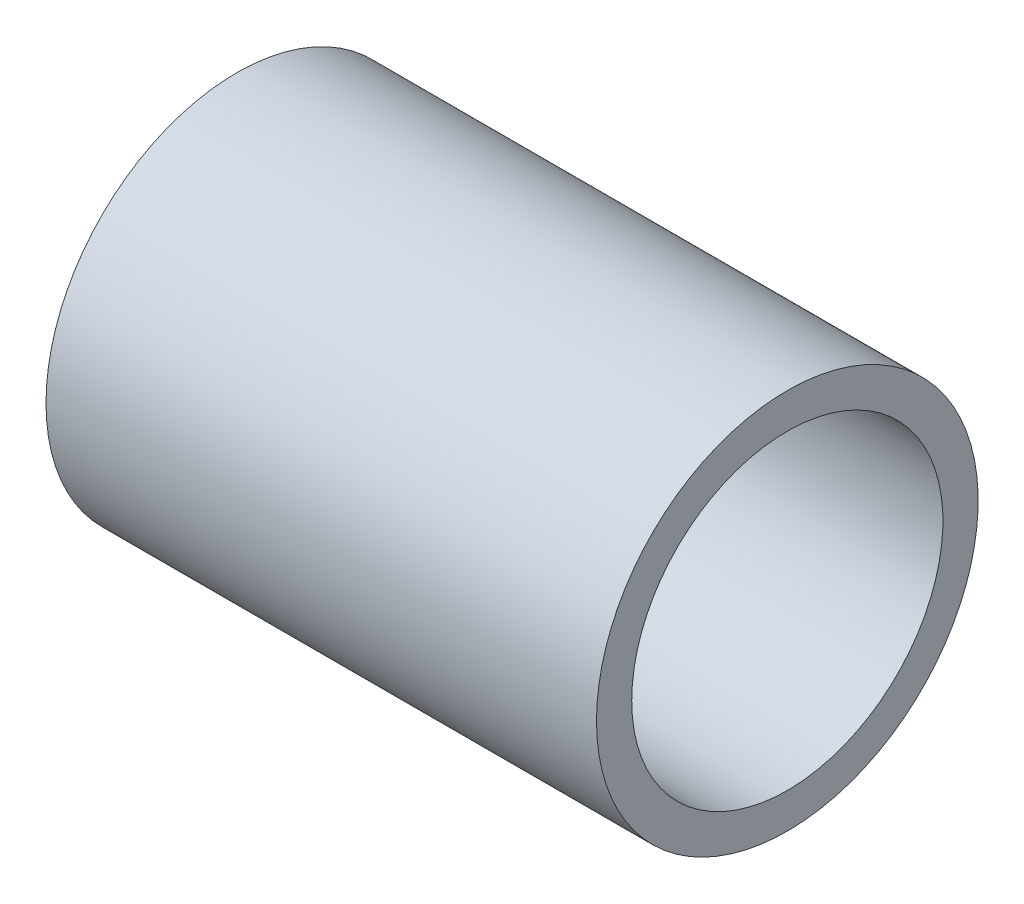
from build123d import *


with BuildPart() as part:
    # Sketch1 → Revolve1 (revolve)
    with BuildSketch(Plane.XY):
        Polygon((-29.765625, -20.6375), (29.765625, -20.6375), (29.765625, -16.8275), (1.190625, -16.637), (1.190625, -13.3223), (-1.190625, -13.3223), (-1.190625, -16.637), (-29.765625, -16.8275), align=None)
    revolve(axis=Axis((-29.765625, 0, 0), (1, 0, 0)))


solid = part.part
